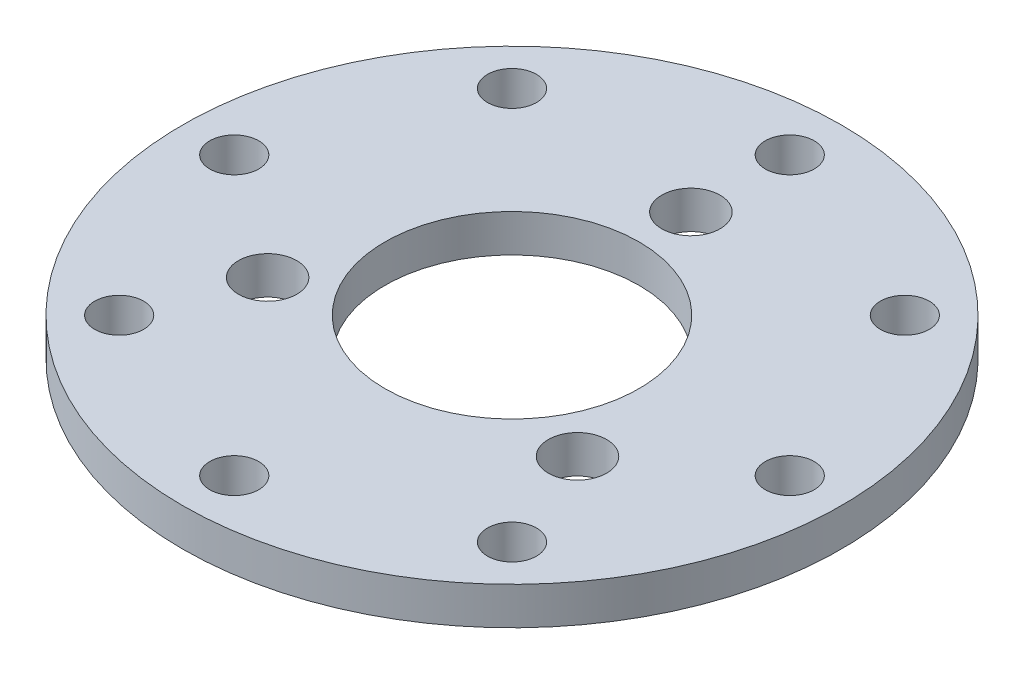
from build123d import *

# Parameters (mm, degrees)
SKETCH_1_R               = 17.5
SKETCH_1_R_2             = 6.75
SKETCH_1_R_3             = 1.55
EXTRUDE_1_DEPTH          = 2
SKETCH_2_R               = 1.3
CUT_EXTRUDE_1_DEPTH      = 25.829418036
PATTERN_CIRCULAR_1_COUNT = 8


with BuildPart() as part:
    # 草图1 → 凸台-拉伸1 (new body)
    with BuildSketch(Plane(origin=(0, 0, 0), x_dir=(1, 0, 0), z_dir=(0, 1, 0))):
        Circle(SKETCH_1_R)
        Circle(SKETCH_1_R_2, mode=Mode.SUBTRACT)
        with Locations((0, 9.5)):
            Circle(SKETCH_1_R_3, mode=Mode.SUBTRACT)
        with Locations((8.227241336, -4.75)):
            Circle(SKETCH_1_R_3, mode=Mode.SUBTRACT)
        with Locations((-8.227241336, -4.75)):
            Circle(SKETCH_1_R_3, mode=Mode.SUBTRACT)
    extrude(amount=EXTRUDE_1_DEPTH)

    # 草图2 → 切除-拉伸1 (cut, through all)
    with BuildSketch(Plane(origin=(0, 2, 0), x_dir=(1, 0, 0), z_dir=(0, 1, 0))):
        with Locations((0, 14.75)):
            Circle(SKETCH_2_R)
    cut_extrude_1 = extrude(amount=-CUT_EXTRUDE_1_DEPTH, mode=Mode.SUBTRACT)

    # 阵列(圆周)1: 切除-拉伸1 ×8 about axis
    pattern_circular_1_axis = Axis((0, 2, 0), (0, 1, 0))
    for i in range(1, PATTERN_CIRCULAR_1_COUNT):
        add(cut_extrude_1.rotate(pattern_circular_1_axis, i * 360 / PATTERN_CIRCULAR_1_COUNT), mode=Mode.SUBTRACT)


solid = part.part
